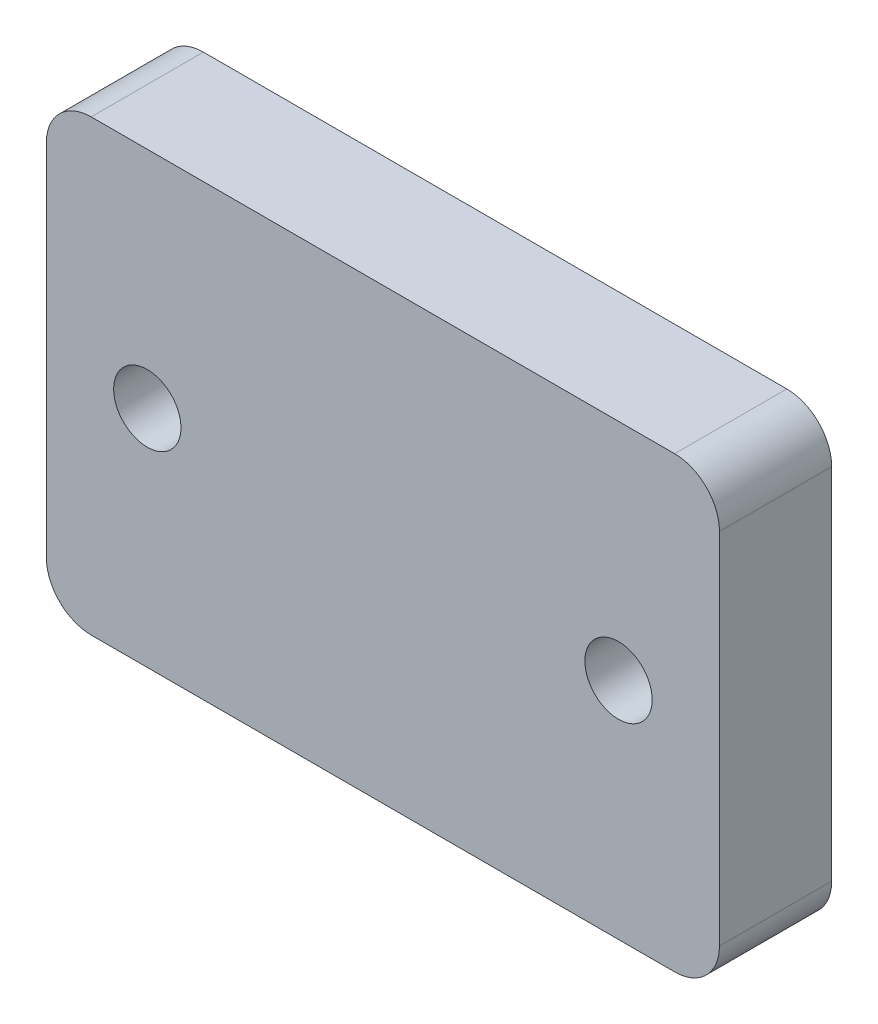
from build123d import *

# Parameters (mm, degrees)
SKETCH_1_W          = 30
SKETCH_1_H          = 20
EXTRUDE_1_DEPTH     = 5
SKETCH_3_R          = 1.5
CUT_EXTRUDE_2_DEPTH = 19.708286934
FILLET_1_R          = 2


with BuildPart() as part:
    # 草图1 → 凸台-拉伸1 (new body)
    with BuildSketch(Plane.XY):
        Rectangle(SKETCH_1_W, SKETCH_1_H)
    extrude(amount=EXTRUDE_1_DEPTH)

    # 草图3 → 切除-拉伸2 (cut, through all)
    with BuildSketch(Plane.XY.offset(5)):
        with Locations((10.5, 0)):
            Circle(SKETCH_3_R)
        with Locations((-10.5, 0)):
            Circle(SKETCH_3_R)
    extrude(amount=-CUT_EXTRUDE_2_DEPTH, mode=Mode.SUBTRACT)

    # 圆角1
    fillet_1_edges = [part.edges().sort_by_distance(p)[0] for p in [
        (15, -10, 2.5),
        (15, 10, 2.5),
        (-15, 10, 2.5),
        (-15, -10, 2.5),
    ]]
    fillet(fillet_1_edges, radius=FILLET_1_R)


solid = part.part
